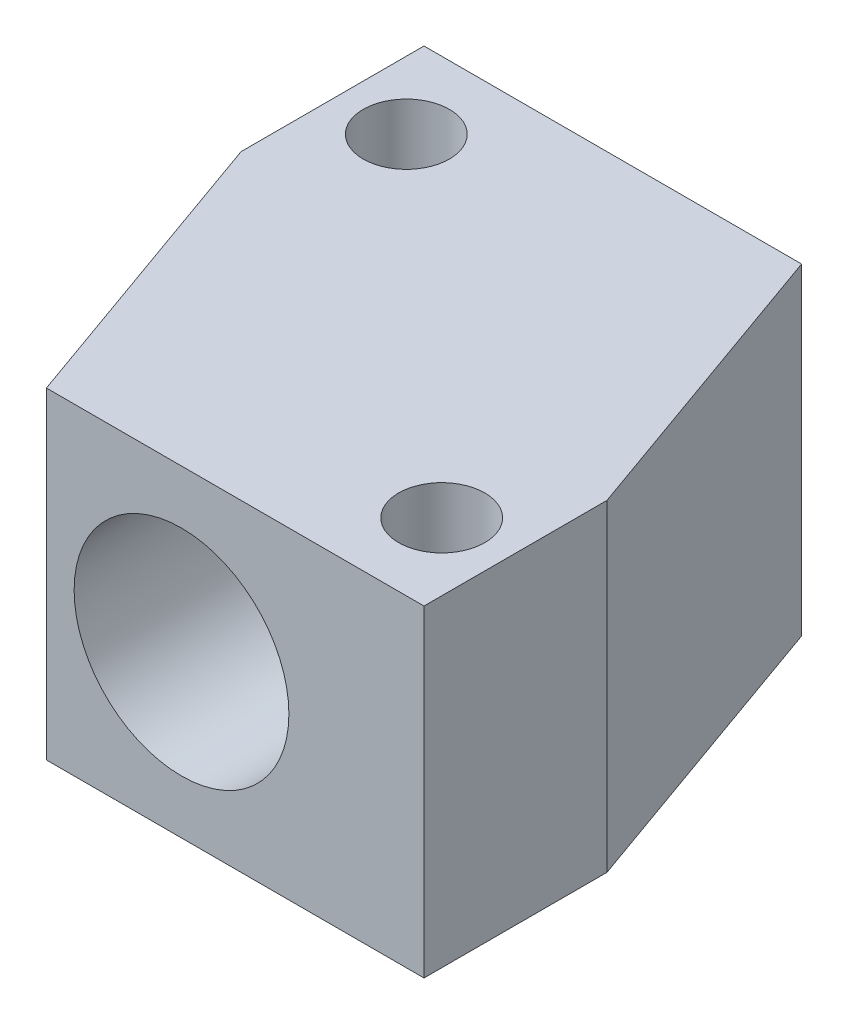
from build123d import *
from build123d.topology import SkipClean

# Parameters (mm, degrees)
SKETCH1_W           = 72.26
SKETCH1_H           = 24
BOSS_EXTRUDE1_DEPTH = 36.13
CUT_EXTRUDE1_DEPTH  = 82.675482857
SKETCH3_R           = 3.39
CUT_EXTRUDE2_DEPTH  = 57.451340108
SKETCH4_R           = 6.42
CUT_EXTRUDE3_DEPTH  = 10.42
CUT_EXTRUDE4_DEPTH  = 71.105305077


with BuildPart() as part:
    # Sketch1 → Boss-Extrude1 (new, symmetric)
    with BuildSketch(Plane.XY):
        Rectangle(SKETCH1_W, SKETCH1_H)
    boss_extrude1 = extrude(amount=BOSS_EXTRUDE1_DEPTH, both=True)

    # Sketch2 → Cut-Extrude1 (cut, through all)
    with BuildSketch(Plane.XY.offset(36.13)):
        with BuildLine():
            Line((-16, -12), (16, -12))
            ThreePointArc((16, -12), (0, 4), (-16, -12))
        make_face()
    cut_extrude1 = extrude(amount=-CUT_EXTRUDE1_DEPTH, mode=Mode.SUBTRACT)

    # Sketch3 → Cut-Extrude2 (cut, through all)
    with BuildSketch(Plane(origin=(0, 12, 0), x_dir=(1, 0, 0), z_dir=(0, 1, 0))):
        with Locations((-26.0675, 23.43)):
            Circle(SKETCH3_R)
        with Locations((26.0675, -23.43)):
            Circle(SKETCH3_R)
    cut_extrude2 = extrude(amount=-CUT_EXTRUDE2_DEPTH, mode=Mode.SUBTRACT)

    # Mirror2: Boss-Extrude1, Cut-Extrude1, Cut-Extrude2 across plane
    with SkipClean():  # the faces are left unmerged after this step: merging them gives an invalid solid
        add(boss_extrude1.mirror(Plane(origin=(-36.13, -12, 36.13), x_dir=(0, 0, 1), z_dir=(0, 1, 0))))
        add(cut_extrude1.mirror(Plane(origin=(-36.13, -12, 36.13), x_dir=(0, 0, 1), z_dir=(0, 1, 0))), mode=Mode.SUBTRACT)
        add(cut_extrude2.mirror(Plane(origin=(-36.13, -12, 36.13), x_dir=(0, 0, 1), z_dir=(0, 1, 0))), mode=Mode.SUBTRACT)
    add(part.part.scale(1), mode=Mode.REPLACE)  # the faces are merged on a copy

    # Sketch4 → Cut-Extrude3 (cut)
    with BuildSketch(Plane(origin=(0, 12, 0), x_dir=(1, 0, 0), z_dir=(0, 1, 0))):
        with Locations((-26.0675, 23.43)):
            Circle(SKETCH4_R)
        with Locations((26.0675, -23.43)):
            Circle(SKETCH4_R)
    extrude(amount=-CUT_EXTRUDE3_DEPTH, mode=Mode.SUBTRACT)

    # Sketch5 → Cut-Extrude4 (cut, through all)
    with BuildSketch(Plane(origin=(0, 12, 0), x_dir=(1, 0, 0), z_dir=(0, 1, 0))):
        Polygon((-20.13, -36.13), (-36.13, 8.87), (-36.13, -36.13), align=None)
        Polygon((36.13, 36.13), (36.13, -8.87), (20.13, 36.13), align=None)
    extrude(amount=-CUT_EXTRUDE4_DEPTH, mode=Mode.SUBTRACT)


solid = part.part
